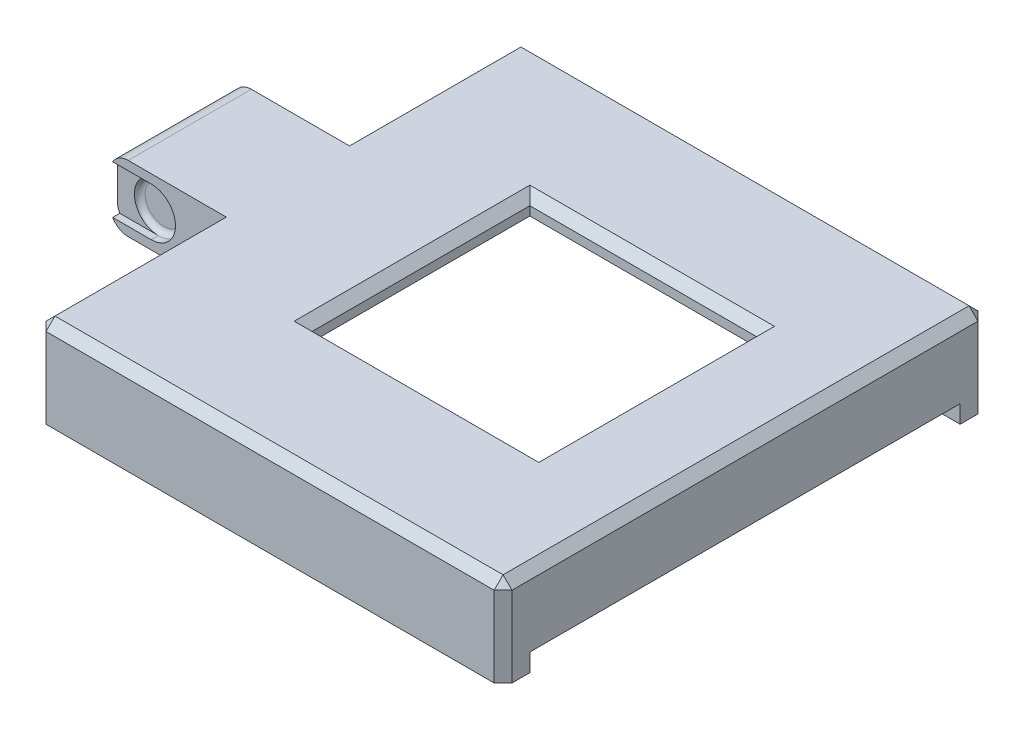
from build123d import *

# Parameters (mm, degrees)
SKETCH1_W            = 26.1
SKETCH1_H            = 27.1
SKETCH1_W_2          = 13
SKETCH1_H_2          = 12.5
BOSS_EXTRUDE1_DEPTH  = 1
BOSS_EXTRUDE2_DEPTH  = 4
SKETCH3_W            = 1
SKETCH3_H            = 24.1
BOSS_EXTRUDE3_DEPTH  = 3
BOSS_EXTRUDE4_DEPTH  = 3
FILLET1_R            = 0.3
BOSS_EXTRUDE5_DEPTH  = 6
FILLET2_R            = 0.3
FILLET2_OF_MIRROR2_R = 0.3
SKETCH8_W            = 13
SKETCH8_H            = 12.5
SKETCH8_W_2          = 12.7
SKETCH8_H_2          = 12.2
BOSS_EXTRUDE6_DEPTH  = 1
SKETCH14_W           = 6
SKETCH14_H           = 3.7
BOSS_EXTRUDE8_DEPTH  = 3.45
SKETCH15_R           = 1.35
CUT_EXTRUDE4_DEPTH   = 0.7
FILLET6_R            = 0.3
CUT_EXTRUDE5_DEPTH   = 0.4
FILLET7_R            = 3
MIRROR4_START        = -2.2
MIRROR4_2_OUTLINE_W  = 2.3
MIRROR4_2_OUTLINE_H  = 0.4
MIRROR4_2_DEPTH      = 2.7
FILLET8_R            = 1
CHAMFER1_SIZE        = 0.5
CHAMFER2_SIZE        = 0.5


with BuildPart() as part:
    # Sketch1 → Boss-Extrude1 (new body)
    with BuildSketch(Plane(origin=(0, 0, 0), x_dir=(1, 0, 0), z_dir=(0, 1, 0))):
        with Locations((5.25, 6.25)):
            Rectangle(SKETCH1_W, SKETCH1_H)
        with Locations((6.5, 6.25)):
            Rectangle(SKETCH1_W_2, SKETCH1_H_2, mode=Mode.SUBTRACT)
    extrude(amount=BOSS_EXTRUDE1_DEPTH)

    # Sketch2 → Boss-Extrude2 (add)
    with BuildSketch(Plane.XZ):
        Polygon((-7.8, 7.3), (-7.8, -19.8), (18.3, -19.8), (18.3, -18.3), (17.3, -18.3), (17.3, -18.8), (-6.8, -18.8), (-6.8, 6.3), (17.3, 6.3), (17.3, 5.8), (18.3, 5.8), (18.3, 7.3), align=None)
    extrude(amount=BOSS_EXTRUDE2_DEPTH)

    # Sketch3 → Boss-Extrude3 (add)
    with BuildSketch(Plane.XZ):
        with Locations((17.8, -6.25)):
            Rectangle(SKETCH3_W, SKETCH3_H)
    extrude(amount=BOSS_EXTRUDE3_DEPTH)

    # Sketch4 → Boss-Extrude4 (add, symmetric)
    with BuildSketch(Plane.XY.offset(-12.5)):
        Polygon((-6.8, -4), (-6.25, -3.570292905), (-6.8, -3.4), align=None)
    extrude(amount=BOSS_EXTRUDE4_DEPTH, both=True)

    # Fillet1
    # the kernel refuses this fillet: 0.3 mm, written as the material it adds along each edge
    with BuildSketch(Plane(origin=(-6.8, -2.65, -15.5), x_dir=(0, 0, -1), z_dir=(0, -1, 0))) as fillet1_piece_1_section:
        with BuildLine():
            CenterArc((FILLET1_R, FILLET1_R), FILLET1_R, 180, 90)
            Line((0, FILLET1_R), (0, 0))
            Line((0, 0), (FILLET1_R, 0))
        make_face()
    fillet1_piece_1 = extrude(amount=1.35, mode=Mode.PRIVATE)
    fillet1_piece_1 = split(fillet1_piece_1, bisect_by=Plane(origin=(-7.011903145, -3.334389814, -15.5), z_dir=(-0.2957706001702403, -0.9552589973797346, 0)), keep=Keep.TOP, mode=Mode.PRIVATE)
    fillet1_piece_1 = split(fillet1_piece_1, bisect_by=Plane(origin=(-6.145050385, -3.48829728, -15.5), z_dir=(-0.6156614753256621, 0.7880107536067191, 0)), keep=Keep.TOP, mode=Mode.PRIVATE)
    add(fillet1_piece_1)
    with BuildSketch(Plane(origin=(-6.8, -2.65, -9.5), x_dir=(0, 0, 1), z_dir=(0, -1, 0))) as fillet1_piece_2_section:
        with BuildLine():
            CenterArc((FILLET1_R, -FILLET1_R), FILLET1_R, 90, 90)
            Line((0, -FILLET1_R), (0, 0))
            Line((0, 0), (FILLET1_R, 0))
        make_face()
    fillet1_piece_2 = extrude(amount=1.35, mode=Mode.PRIVATE)
    fillet1_piece_2 = split(fillet1_piece_2, bisect_by=Plane(origin=(-7.011903145, -3.334389814, -9.5), z_dir=(-0.2957706001702403, -0.9552589973797346, 0)), keep=Keep.TOP, mode=Mode.PRIVATE)
    fillet1_piece_2 = split(fillet1_piece_2, bisect_by=Plane(origin=(-6.145050385, -3.48829728, -9.5), z_dir=(-0.6156614753256621, 0.7880107536067191, 0)), keep=Keep.TOP, mode=Mode.PRIVATE)
    add(fillet1_piece_2)

    # Sketch6 → Boss-Extrude5 (add)
    with BuildSketch(Plane.ZY.offset(-13)):
        Polygon((-18.8, -4), (-18.25, -3.570292905), (-18.8, -3.4), align=None)
    boss_extrude5 = extrude(amount=BOSS_EXTRUDE5_DEPTH)

    # Fillet2
    fillet2_edges = [part.edges().sort_by_distance(p)[0] for p in [
        (13, -3.7, -18.8),
        (7, -3.7, -18.8),
    ]]
    fillet(fillet2_edges, radius=FILLET2_R)

    # Mirror2: Boss-Extrude5 across plane
    add(boss_extrude5.mirror(Plane(origin=(0, 0, -6.25), x_dir=(1, 0, 0), z_dir=(0, 0, -1))))

    # Fillet2 of Mirror2
    fillet2_of_mirror2_edges = [part.edges().sort_by_distance(p)[0] for p in [
        (13, -3.7, 6.3),
        (7, -3.7, 6.3),
    ]]
    fillet(fillet2_of_mirror2_edges, radius=FILLET2_OF_MIRROR2_R)

    # Sketch8 → Boss-Extrude6 (add)
    with BuildSketch(Plane(origin=(0, 1, 0), x_dir=(1, 0, 0), z_dir=(0, 1, 0))):
        with Locations((6.5, 6.25)):
            Rectangle(SKETCH8_W, SKETCH8_H)
        with Locations((6.5, 6.25)):
            Rectangle(SKETCH8_W_2, SKETCH8_H_2, mode=Mode.SUBTRACT)
    extrude(amount=-BOSS_EXTRUDE6_DEPTH)

    # Sketch14 → Boss-Extrude8 (add, symmetric)
    with BuildSketch(Plane(origin=(0, 0, -6.25), x_dir=(-1, 0, 0), z_dir=(0, 0, -1))):
        with Locations((10.8, -0.85)):
            Rectangle(SKETCH14_W, SKETCH14_H)
    extrude(amount=BOSS_EXTRUDE8_DEPTH, both=True)

    # Sketch15 → Cut-Extrude4 (cut)
    with BuildSketch(Plane(origin=(0, 0, -9.7), x_dir=(-1, 0, 0), z_dir=(0, 0, -1))):
        with Locations((11.5, -0.85)):
            Circle(SKETCH15_R)
    extrude(amount=-CUT_EXTRUDE4_DEPTH, mode=Mode.SUBTRACT)

    # Fillet6
    fillet6_edges = [part.edges().sort_by_distance(p)[0] for p in [
        (-10.15, -0.85, -9),
    ]]
    fillet(fillet6_edges, radius=FILLET6_R)

    # Sketch16 → Cut-Extrude5 (cut)
    with BuildSketch(Plane(origin=(0, 0, -9.7), x_dir=(-1, 0, 0), z_dir=(0, 0, -1))):
        with BuildLine():
            Line((13.8, 0.5), (11.5, 0.5))
            ThreePointArc((11.5, 0.5), (12.454594155, 0.104594155), (12.85, -0.85))
            ThreePointArc((12.85, -0.85), (12.454594155, -1.804594155), (11.5, -2.2))
            Line((11.5, -2.2), (13.8, -2.2))
            Line((13.8, -2.2), (13.8, 0.5))
        make_face()
    extrude(amount=-CUT_EXTRUDE5_DEPTH, mode=Mode.SUBTRACT)

    # Fillet7
    # the kernel refuses this fillet: 3 mm, written as the material it adds along each edge
    with BuildSketch(Plane(origin=(-7.8, -2.7, -2.8), x_dir=(-1, 0, 0), z_dir=(0, 0, -1))) as fillet7_piece_1:
        with BuildLine():
            CenterArc((2.471841419, -3), FILLET7_R, 90, 55.481892159)
            Line((0, -1.3), (-0.049436828, -1.266))
            ThreePointArc((-0.049436828, -1.266), (-0.06, -0.65), (-0.06, 0))
            Line((-0.06, 0), (0, 0.06))
            Line((0, 0.06), (2.471841419, 0.06))
            Line((2.471841419, 0.06), (2.471841419, 0))
        make_face()
    extrude(amount=6.9)

    # Mirror4: read off the stored shape, not the designer's step
    # Mirror4 outline → Mirror4 (revolve, cut)
    with BuildSketch(Plane(origin=(-11.5, -0.85, 0), x_dir=(1, 0, 0), z_dir=(0, -1, 0))):
        with BuildLine():
            Line((0, -2.8), (0, -3.5))
            Line((0, -3.5), (1.05, -3.5))
            ThreePointArc((1.05, -3.5), (1.262132034, -3.412132034), (1.35, -3.2))
            Line((1.35, -3.2), (1.35, -2.8))
            Line((1.35, -2.8), (0, -2.8))
        make_face()
    revolve(axis=Axis((-11.5, -0.85, 0), (0, 0, 1)), mode=Mode.SUBTRACT)

    # Mirror4 2 outline → Mirror4 2 (cut)
    with BuildSketch(Plane(origin=(0, 0, 0), x_dir=(1, 0, 0), z_dir=(0, 1, 0)).offset(MIRROR4_START)):
        with Locations((-12.65, 3)):
            Rectangle(MIRROR4_2_OUTLINE_W, MIRROR4_2_OUTLINE_H)
    extrude(amount=MIRROR4_2_DEPTH, mode=Mode.SUBTRACT)

    # Fillet8
    fillet8_edges = [part.edges().sort_by_distance(p)[0] for p in [
        (-13.8, 1, -6.25),
        (-13.8, -2.7, -6.25),
    ]]
    fillet(fillet8_edges, radius=FILLET8_R)

    # Chamfer1
    chamfer1_edges = [part.edges().sort_by_distance(p)[0] for p in [
        (-7.8, 1, -14.75),
        (5.25, 1, 7.3),
        (18.3, -1.5, -19.8),
        (18.3, -1.5, 7.3),
        (-7.8, -1.5, 7.3),
        (-7.8, -1.5, -19.8),
        (6.5, 1, -0.15),
        (12.85, 1, -6.25),
        (6.5, 1, -12.35),
        (0.15, 1, -6.25),
        (18.3, 1, -6.25),
        (-7.8, 1, 2.25),
        (-7.8, -4, -14.75),
        (-7.8, -4, 2.25),
        (5.25, 1, -19.8),
    ]]
    chamfer(chamfer1_edges, length=CHAMFER1_SIZE)

    # Chamfer2
    chamfer2_edges = [part.edges().sort_by_distance(p)[0] for p in [
        (-7.8, -1.5, -2.8),
        (-7.8, -1.5, -9.7),
    ]]
    chamfer(chamfer2_edges, length=CHAMFER2_SIZE)


solid = part.part
